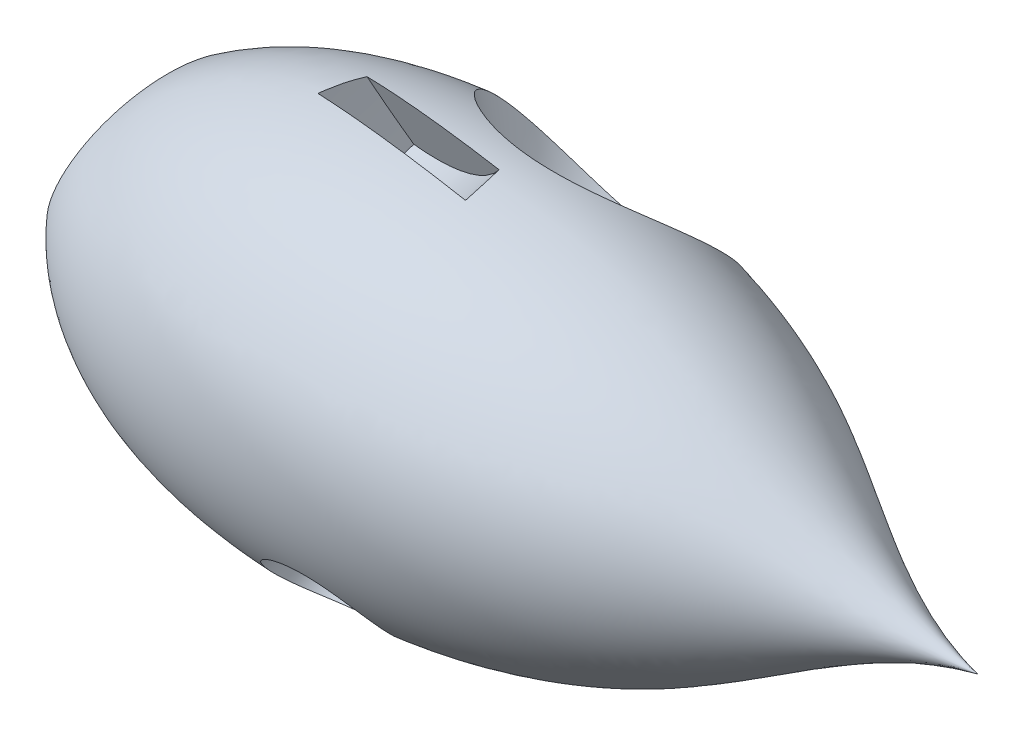
from build123d import *

# Parameters (mm, degrees)
TAGLIO_ESTRUSIONE1_DEPTH               = 3.5
TAGLIO_ESTRUSIONE2_DEPTH               = 3.5
SCALA1_SCALE                           = 2
SCALA2_SCALE                           = 0.7075
FORO_SVASATO_PER_VITE_M6_3_D           = 14
FORO_SVASATO_PER_VITE_M6_3_CSINK_D     = 35
FORO_SVASATO_PER_VITE_M6_3_CSINK_ANGLE = 90
SCHIZZO14_R                            = 7.5
TAGLIO_ESTRUSIONE3_DEPTH               = 7
SCALA7_SCALE                           = 1.5


with BuildPart() as part:
    # Schizzo1 → Rivoluzione1 (revolve)
    with BuildSketch(Plane.XY):
        with BuildLine():
            Line((-35.006441432, 0), (50.714460024, 0))
            add(Edge.make_bspline(
                [(-35.006441432, 0), (-29.333672768, 14.125192441), (-4.453158847, 20.511242), (27.336416125, 14.104103512), (41.52667598, 1.83959961), (50.714460024, 0)],
                knots=[0, 0, 0, 0, 0.432439413, 0.714133656, 1, 1, 1, 1], degree=3))
        make_face()
    revolve(axis=Axis((-35.006441432, 0, 0), (1, 0, 0)))

    # Schizzo2 → Taglio-Estrusione1 (cut)
    with BuildSketch(Plane(origin=(0.622440923, 3.385466843, -1.752691354), x_dir=(0.9869315872837755, -0.14309983504109458, 0.07408427115615773), z_dir=(-0.16113982134012556, -0.8764422484933347, 0.45374325673713334))):
        with BuildLine():
            add(Edge.make_bspline(
                [(-7.928304849, -4.197719776), (-10.175999374, -8.689309791), (-11.846543005, -13.455281461), (-12.94611516, -18.370545978)],
                knots=[0, 0, 0, 0, 0.233885507, 0.233885507, 0.233885507, 0.233885507], degree=3))
            Line((-12.94611516, -18.370545978), (5.284317115, -17.547748504))
            add(Edge.make_bspline(
                [(5.284317115, -17.547748504), (4.69669727, -16.201306007), (1.766965951, -10.458857022), (-3.067198953, -5.588746309), (-7.928304849, -4.197719776)],
                knots=[0.725363538, 0.725363538, 0.725363538, 0.725363538, 0.788086285, 1, 1, 1, 1], degree=3))
        make_face()
    extrude(amount=-TAGLIO_ESTRUSIONE1_DEPTH, mode=Mode.SUBTRACT)

    # Schizzo3 → Taglio-Estrusione2 (cut)
    with BuildSketch(Plane(origin=(0.627520668, 2.440772957, -5.025661597), x_dir=(0.9937514083145423, -0.04876124041909747, 0.10040159314301102), z_dir=(-0.1116160314330506, -0.4341361246722632, 0.8939058601338764))):
        with BuildLine():
            Line((6.437211098, 20.65969455), (-12.72569509, 18.907408898))
            add(Edge.make_bspline(
                [(-12.72569509, 18.907408898), (-12.277994855, 14.823136114), (-11.435405801, 10.79382103), (-10.184134048, 6.886328791)],
                knots=[0.808939614, 0.808939614, 0.808939614, 0.808939614, 1, 1, 1, 1], degree=3))
            add(Edge.make_bspline(
                [(-10.184134048, 6.886328791), (-5.167134664, 7.514836973), (1.22091196, 12.221774722), (5.27163489, 18.472153245), (6.437211098, 20.65969455)],
                knots=[0, 0, 0, 0, 0.211913715, 0.317576046, 0.317576046, 0.317576046, 0.317576046], degree=3))
        make_face()
    extrude(amount=-TAGLIO_ESTRUSIONE2_DEPTH, mode=Mode.SUBTRACT)

    # Schizzo4<7> → Taglia-Rivoluzione3 (revolve, cut)
    with BuildSketch(Plane(origin=(0.036949903, 0.420708846, 0.540197317), x_dir=(0.9985470412751198, -0.03311063159070362, -0.04251461438574898), z_dir=(0.05388697765419985, 0.61355311893375, 0.7878126451675953))):
        with BuildLine():
            Line((-14.23768025, 1.582111274), (-54.66996697, 10.599314969))
            ThreePointArc((-54.66996697, 10.599314969), (-44.917724499, -6.8469757), (-26.486863271, 0.884948103))
            Line((-26.486863271, 0.884948103), (-14.23768025, 1.582111274))
        make_face()
    revolve(axis=Axis((-14.180043586, 2.140348312, 0.173385043), (-0.9746037934160391, 0.20405120691533443, -0.09225264665830517)), mode=Mode.SUBTRACT)


with BuildPart() as part_1:
    # Scala1: scaled about (2.032638935, -0.169349585, 0.166295134)
    add(part.part.scale(SCALA1_SCALE).moved(Location((-2.032638935, 0.169349585, -0.166295134))))


with BuildPart() as part_2:
    # Scala2: scaled about (2.032638935, -0.169349586, 0.166295133)
    add(part_1.part.scale(SCALA2_SCALE).moved(Location((0.594546888, -0.049534754, 0.048641326))))

    # Foro svasato per Vite M6-3 (through all)
    with Locations(Plane(origin=(4.783160121, 17.423312339, -18.110189209), x_dir=(0, -0.72071817041, -0.693228186704), z_dir=(0.064883847999, 0.691767432239, -0.719199489685))):
        with Locations((0, 0)):
            CounterSinkHole(FORO_SVASATO_PER_VITE_M6_3_D / 2, FORO_SVASATO_PER_VITE_M6_3_CSINK_D / 2, counter_sink_angle=FORO_SVASATO_PER_VITE_M6_3_CSINK_ANGLE)

    # Schizzo14 → Taglio-Estrusione3 (cut)
    with BuildSketch(Plane(origin=(-3.170212917, -16.96049394, 19.612355086), x_dir=(-0.9926082753830303, 0.07938526183407578, -0.09179755903433223), z_dir=(0.1213623155725305, 0.6492828310684252, -0.7508015674188783))):
        with Locations((-4.536103003, -1.272106625)):
            Circle(SCHIZZO14_R)
    extrude(amount=TAGLIO_ESTRUSIONE3_DEPTH, mode=Mode.SUBTRACT)


with BuildPart() as part_3:
    # Scala7: scaled about (1.913499727, -0.461636151, 0.469762035)
    add(part_2.part.scale(SCALA7_SCALE).moved(Location((-0.956749864, 0.230818075, -0.234881018))))


solid = part_3.part
